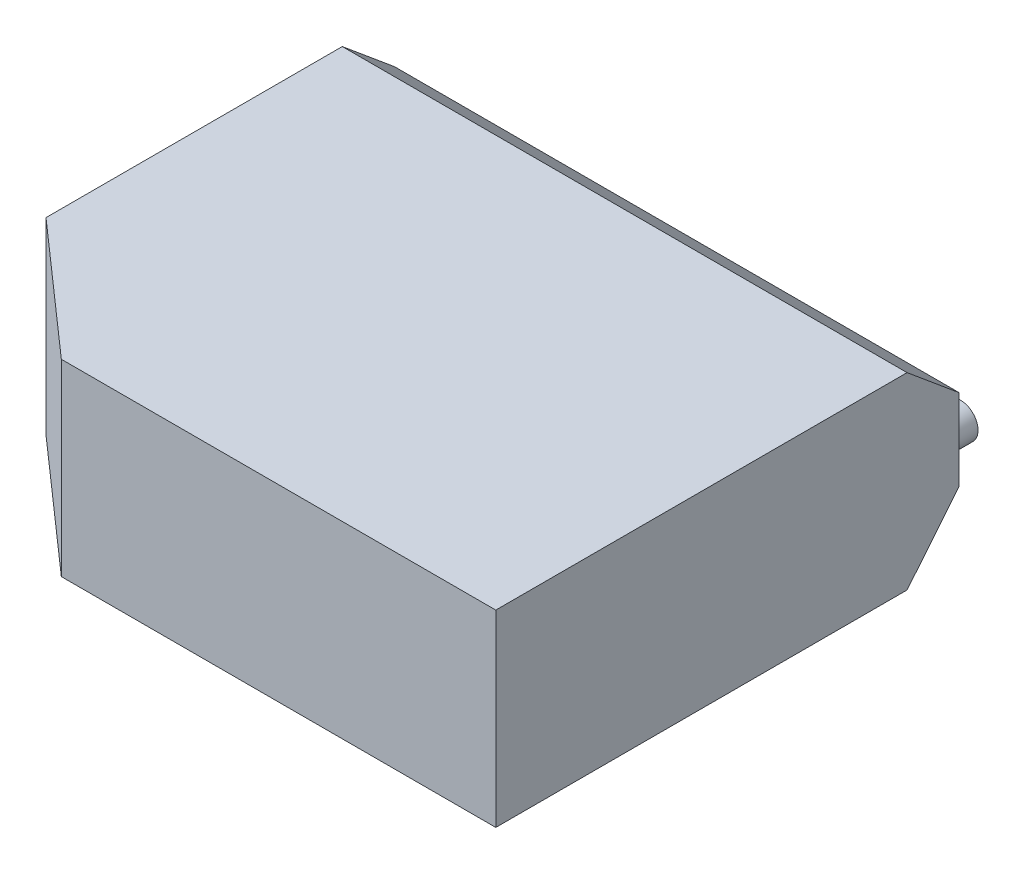
from build123d import *

# Parameters (mm, degrees)
SKETCH_1_W           = 19.5
SKETCH_1_H           = 6.5
EXTRUDE_1_DEPTH      = 16
CUT_EXTRUDE_1_DEPTH  = 27.048032555
CUT_EXTRUDE_2_DEPTH  = 27.048032555
EXTRUDE_2_DEPTH      = 2
EXTRUDE_2_DEPTH_BACK = 2
SKETCH_5_R           = 0.6


with BuildPart() as part:
    # 草图1 → 凸台-拉伸1 (new body)
    with BuildSketch(Plane.XY):
        with Locations((9.75, 3.25)):
            Rectangle(SKETCH_1_W, SKETCH_1_H)
    extrude(amount=EXTRUDE_1_DEPTH)

    # 草图2 → 切除-拉伸1 (cut, through all)
    with BuildSketch(Plane.XZ):
        Polygon((4.5, 16), (-0.033447317, 12), (0, 16), align=None)
    extrude(amount=-CUT_EXTRUDE_1_DEPTH, mode=Mode.SUBTRACT)

    # 草图4 → 切除-拉伸2 (cut, through all)
    with BuildSketch(Plane(origin=(19.5, 0, 0), x_dir=(0, 0, -1), z_dir=(1, 0, 0))):
        Polygon((-1.8, 0), (0, 2.2), (0, 0), align=None)
        Polygon((0, 5), (-1.8, 6.5), (0, 6.5), align=None)
    extrude(amount=-CUT_EXTRUDE_2_DEPTH, mode=Mode.SUBTRACT)

    # 草图5 → 凸台-拉伸2 (add, two sides: drawn at the far end of the back side and taken through both)
    with BuildSketch(Plane(origin=(0, 0, 0), x_dir=(-1, 0, 0), z_dir=(0, 0, -1)).offset(-EXTRUDE_2_DEPTH_BACK)):
        with Locations((-12.35, 2.2)):
            Circle(SKETCH_5_R)
        with Locations((-17.55, 2.2)):
            Circle(SKETCH_5_R)
        with Locations((-7.15, 2.2)):
            Circle(SKETCH_5_R)
        with Locations((-1.95, 2.2)):
            Circle(SKETCH_5_R)
    extrude(amount=EXTRUDE_2_DEPTH + EXTRUDE_2_DEPTH_BACK)


solid = part.part
